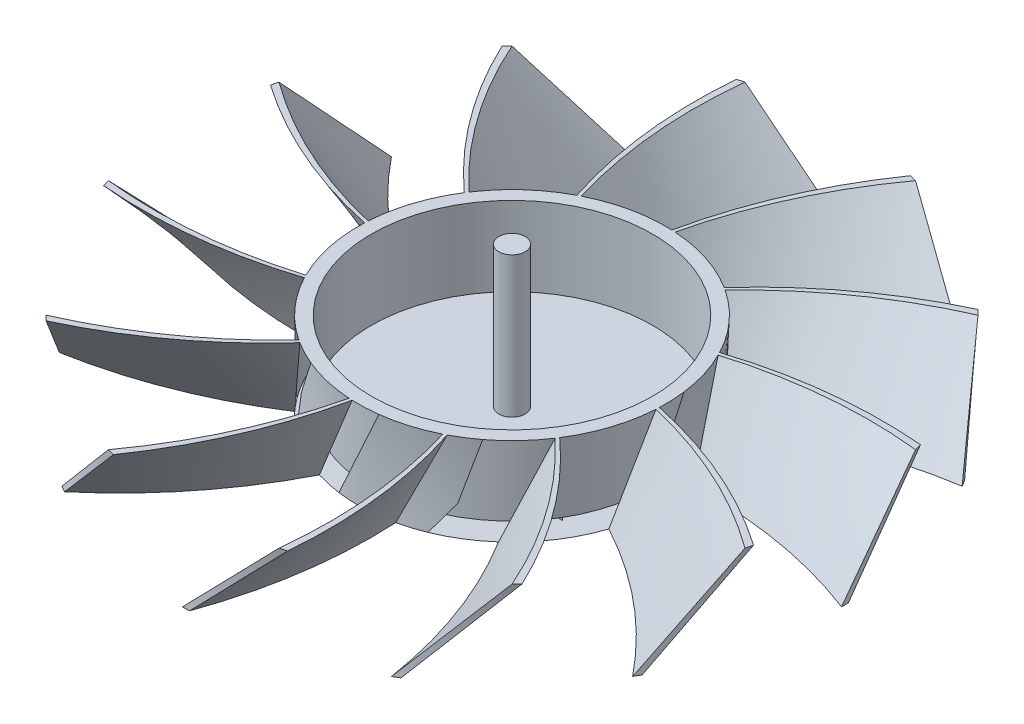
from build123d import *

# Parameters (mm, degrees)
CIRPATTERN1_COUNT   = 12
CUT_EXTRUDE1_DEPTH  = 0.5
CUT_EXTRUDE2_DEPTH  = 0.5
SKETCH5_R           = 16
CUT_EXTRUDE3_DEPTH  = 9
SKETCH6_R           = 1.5
BOSS_EXTRUDE1_DEPTH = 16


with BuildPart() as part:
    # Sketch2 → Loft2 section 0
    with BuildSketch(Plane(origin=(0, 10, 0), x_dir=(1, 0, 0), z_dir=(0, 1, 0))):
        with BuildLine():
            ThreePointArc((-8.126827561, 15.498537795), (7.961047485, -15.584342236), (-7.794361593, 15.668373475))
            ThreePointArc((-7.794361593, 15.668373475), (-9.780197697, 25.849498887), (-9.705714191, 36.222218486))
            ThreePointArc((-9.705714191, 36.222218486), (-10.091532359, 36.116630167), (-10.476202302, 36.006932462))
            ThreePointArc((-10.476202302, 36.006932462), (-10.329396762, 25.634984342), (-8.126827561, 15.498537795))
        make_face()
    # Sketch1 → Loft2 section 1
    with BuildSketch(Plane(origin=(0, 0, 0), x_dir=(1, 0, 0), z_dir=(0, 1, 0))):
        with BuildLine():
            ThreePointArc((-3.838616601, 17.073811015), (3.656267182, -17.113787141), (-3.473501701, 17.15181582))
            ThreePointArc((-3.473501701, 17.15181582), (-2.756602923, 27.5), (0, 37.5))
            ThreePointArc((0, 37.5), (-0.40002276, 37.497866363), (-0.8, 37.491465696))
            ThreePointArc((-0.8, 37.491465696), (-3.342642238, 27.434933981), (-3.838616601, 17.073811015))
        make_face()
    loft2 = loft()

    # CirPattern1: Loft2 ×12 about axis
    cirpattern1_axis = Axis((0, 10, 0), (0, 1, 0))
    for i in range(1, CIRPATTERN1_COUNT):
        add(loft2.rotate(cirpattern1_axis, i * 360 / CIRPATTERN1_COUNT))

    # Sketch3 → Cut-Extrude1 (cut)
    # profile 1 of 5: a face of its own
    with BuildSketch(Plane.XZ):
        with BuildLine():
            Line((-9.7096928, 2.305994157), (-9.599607596, 2.305994157))
            Line((-9.599607596, 2.305994157), (-9.599607596, 0.813313427))
            Line((-9.599607596, 0.813313427), (-9.7096928, 0.813313427))
            add(Edge.make_bspline(
                [(-9.7096928, 0.813313427), (-9.726150452, 0.857292674), (-9.758237442, 0.943037691), (-9.810953402, 1.06671536), (-9.865067608, 1.182923357), (-9.919315189, 1.292629176), (-9.977972031, 1.393350754), (-10.036453633, 1.487505207), (-10.095718212, 1.575257412), (-10.139074665, 1.628669335), (-10.160295796, 1.654812189)],
                knots=[0, 0, 0, 0, 1.175104864, 2.291066666, 3.363545726, 4.383364311, 5.352569365, 6.279020888, 7.157654259, 8, 8, 8, 8], degree=3))
            add(Edge.make_bspline(
                [(-10.160295796, 1.654812189), (-10.192043735, 1.689300981), (-10.256640251, 1.759474225), (-10.366220387, 1.855118159), (-10.487541147, 1.943764348), (-10.618823251, 2.026863972), (-10.760540357, 2.101982438), (-10.910910943, 2.169448284), (-11.070129361, 2.227033327), (-11.235944931, 2.275883896), (-11.406171709, 2.31628229), (-11.578480694, 2.345161084), (-11.752130874, 2.362466212), (-11.868132661, 2.364620641), (-11.926323684, 2.365701386)],
                knots=[0, 0, 0, 0, 0.861605881, 1.753081951, 2.669309869, 3.622901531, 4.607925055, 5.616572816, 6.651453525, 7.719095936, 8.794187388, 9.866964194, 10.929985983, 12, 12, 12, 12], degree=3))
            add(Edge.make_bspline(
                [(-11.926323684, 2.365701386), (-11.96864764, 2.364757792), (-12.051325576, 2.362914523), (-12.171841875, 2.349970915), (-12.285517148, 2.327627858), (-12.39179528, 2.296187872), (-12.49030217, 2.255652291), (-12.581756366, 2.208154522), (-12.665446554, 2.151478981), (-12.714538667, 2.106352803), (-12.738901757, 2.083957899)],
                knots=[0, 0, 0, 0, 1.151586221, 2.249571708, 3.29339928, 4.300036893, 5.2601469, 6.18747997, 7.100495241, 8, 8, 8, 8], degree=3))
            add(Edge.make_bspline(
                [(-12.738901757, 2.083957899), (-12.77044443, 2.049888334), (-12.833226805, 1.982076449), (-12.890854307, 1.882060857), (-12.925987122, 1.800221602), (-12.945120999, 1.739668889), (-12.956746238, 1.680140441), (-12.958309082, 1.640555043), (-12.959072165, 1.621226872)],
                knots=[0, 0, 0, 0, 1.588777153, 3.16229386, 3.927156337, 4.642500351, 5.337180238, 6, 6, 6, 6], degree=3))
            add(Edge.make_bspline(
                [(-12.959072165, 1.621226872), (-12.956869811, 1.586141857), (-12.952528148, 1.516976147), (-12.919071159, 1.41710832), (-12.864107798, 1.324891765), (-12.813461191, 1.272919784), (-12.787413881, 1.246190839)],
                knots=[0, 0, 0, 0, 0.990804432, 1.953246749, 2.947364462, 4, 4, 4, 4], degree=3))
            add(Edge.make_bspline(
                [(-12.787413881, 1.246190839), (-12.773094603, 1.232769769), (-12.743141413, 1.204695458), (-12.689484454, 1.167682738), (-12.628361869, 1.130760696), (-12.558475685, 1.093858942), (-12.478928076, 1.058563374), (-12.388813032, 1.024682325), (-12.289076981, 0.988543619), (-12.175772554, 0.954206253), (-12.04566629, 0.916699963), (-11.893573364, 0.878988361), (-11.719348615, 0.832987041), (-11.594902317, 0.803672522), (-11.52889744, 0.78812444)],
                knots=[0, 0, 0, 0, 0.522106973, 1.092147927, 1.731407964, 2.424284969, 3.195516386, 4.047724456, 4.988264309, 6.020516799, 7.200406023, 8.594674768, 10.193854901, 12, 12, 12, 12], degree=3))
            add(Edge.make_bspline(
                [(-11.52889744, 0.78812444), (-11.511480521, 0.783153401), (-11.479768524, 0.774102342), (-11.436990427, 0.761822733), (-11.403178181, 0.752869202), (-11.383383165, 0.749458955), (-11.37496474, 0.748008645)],
                knots=[0, 0, 0, 0, 1.365477475, 2.486204181, 3.356212868, 4, 4, 4, 4], degree=3))
            Line((-11.37496474, 0.748008645), (-11.220099114, 0.710691627))
            Line((-11.220099114, 0.710691627), (-10.974739719, 0.648185621))
            add(Edge.make_bspline(
                [(-10.974739719, 0.648185621), (-10.924633633, 0.635271305), (-10.827699575, 0.610287572), (-10.68792637, 0.571713795), (-10.558067547, 0.535645201), (-10.438882204, 0.50039297), (-10.330355013, 0.465788013), (-10.232307747, 0.432374317), (-10.144972584, 0.399803302), (-10.043175954, 0.359209506), (-9.927311702, 0.30516491), (-9.800105492, 0.228770318), (-9.681951148, 0.14433947), (-9.61200394, 0.078962406), (-9.577217386, 0.046448702)],
                knots=[0, 0, 0, 0, 1.209484786, 2.339840866, 3.389257254, 4.359833054, 5.244898727, 6.051764187, 6.780883699, 7.423404301, 8.613489217, 9.764137735, 10.888047912, 12, 12, 12, 12], degree=3))
            add(Edge.make_bspline(
                [(-9.577217386, 0.046448702), (-9.551782163, 0.021463072), (-9.501381188, -0.028047017), (-9.435579249, -0.111458341), (-9.378697803, -0.200873419), (-9.331238315, -0.296363752), (-9.292556421, -0.396092088), (-9.265430248, -0.500619287), (-9.249405783, -0.609210034), (-9.247163658, -0.683045572), (-9.246028849, -0.720416023)],
                knots=[0, 0, 0, 0, 0.994566719, 1.970776275, 2.958231928, 3.948279333, 4.943073372, 5.939078914, 6.956904077, 8, 8, 8, 8], degree=3))
            add(Edge.make_bspline(
                [(-9.246028849, -0.720416023), (-9.247444182, -0.758105726), (-9.250278264, -0.833576104), (-9.26847054, -0.94692161), (-9.29971391, -1.059896507), (-9.342279595, -1.17215383), (-9.396346022, -1.280693954), (-9.459910338, -1.384295828), (-9.534726944, -1.480969973), (-9.592150212, -1.539149692), (-9.621064882, -1.568445263)],
                knots=[0, 0, 0, 0, 0.950449327, 1.90319275, 2.886711018, 3.90182826, 4.925871902, 5.939989103, 6.962710778, 8, 8, 8, 8], degree=3))
            add(Edge.make_bspline(
                [(-9.621064882, -1.568445263), (-9.661226688, -1.607106311), (-9.742035845, -1.684895808), (-9.880376685, -1.783449943), (-10.031942053, -1.867174021), (-10.196803062, -1.934769584), (-10.374151452, -1.988522003), (-10.564050382, -2.0244318), (-10.765434159, -2.049023779), (-10.903758657, -2.051409397), (-10.974739719, -2.052633574)],
                knots=[0, 0, 0, 0, 0.9045502, 1.820036154, 2.749312885, 3.711811853, 4.709011819, 5.754176183, 6.847558006, 8, 8, 8, 8], degree=3))
            add(Edge.make_bspline(
                [(-10.974739719, -2.052633574), (-11.024832731, -2.052012918), (-11.123926261, -2.050785141), (-11.270294596, -2.038125304), (-11.412598611, -2.018555008), (-11.554007055, -1.991408132), (-11.700179159, -1.95141378), (-11.858108042, -1.899467115), (-12.031271625, -1.835359729), (-12.150423089, -1.785063707), (-12.2127318, -1.758762056)],
                knots=[0, 0, 0, 0, 0.937141327, 1.853844236, 2.746727261, 3.624310237, 4.546022891, 5.580194318, 6.734594038, 8, 8, 8, 8], degree=3))
            add(Edge.make_bspline(
                [(-12.2127318, -1.758762056), (-12.252204719, -1.743163811), (-12.326000453, -1.714002452), (-12.429092973, -1.674107595), (-12.518079542, -1.64445818), (-12.614008578, -1.614802326), (-12.721083091, -1.589283323), (-12.80499097, -1.585288863), (-12.845255259, -1.58337207)],
                knots=[0, 0, 0, 0, 1.157313997, 2.163631113, 3.013629022, 3.713717744, 4.902897683, 6, 6, 6, 6], degree=3))
            add(Edge.make_bspline(
                [(-12.845255259, -1.58337207), (-12.881152395, -1.584651439), (-12.951266318, -1.587150289), (-13.051905531, -1.611116766), (-13.144044479, -1.649785725), (-13.226819781, -1.703143429), (-13.298455069, -1.771275024), (-13.358033528, -1.852481556), (-13.403487206, -1.947550366), (-13.421705015, -2.016798666), (-13.431132445, -2.052633574)],
                knots=[0, 0, 0, 0, 1.052167561, 2.055083061, 3.01626263, 3.973229431, 4.928758788, 5.901782621, 6.914205425, 8, 8, 8, 8], degree=3))
            Line((-13.431132445, -2.052633574), (-13.541217649, -2.052633574))
            Line((-13.541217649, -2.052633574), (-13.541217649, -0.022587782))
            Line((-13.541217649, -0.022587782), (-13.431132445, -0.022587782))
            add(Edge.make_bspline(
                [(-13.431132445, -0.022587782), (-13.424693705, -0.066881136), (-13.411903946, -0.154864396), (-13.380064791, -0.284373362), (-13.34096774, -0.411174963), (-13.289108975, -0.533865505), (-13.23117861, -0.654668133), (-13.161351277, -0.771635832), (-13.082073619, -0.885439163), (-13.023277748, -0.958038891), (-12.993590406, -0.994696107)],
                knots=[0, 0, 0, 0, 0.992729715, 1.971934528, 2.956281341, 3.934123375, 4.924860161, 5.927328838, 6.953462282, 8, 8, 8, 8], degree=3))
            add(Edge.make_bspline(
                [(-12.993590406, -0.994696107), (-12.954548699, -1.037447811), (-12.874777498, -1.12479939), (-12.737218114, -1.244462369), (-12.586825527, -1.362210167), (-12.421554008, -1.472905381), (-12.246932667, -1.575671735), (-12.065585747, -1.667325599), (-11.879785665, -1.74658579), (-11.691376349, -1.813556376), (-11.503527844, -1.866876323), (-11.318793655, -1.903781304), (-11.139627646, -1.928973604), (-11.021466467, -1.931822571), (-10.963544614, -1.933219116)],
                knots=[0, 0, 0, 0, 0.907489387, 1.854209885, 2.85534158, 3.902523447, 4.971720046, 6.031954649, 7.087533207, 8.138219963, 9.166761867, 10.147348753, 11.091842218, 12, 12, 12, 12], degree=3))
            add(Edge.make_bspline(
                [(-10.963544614, -1.933219116), (-10.913727888, -1.931936668), (-10.815606105, -1.929410688), (-10.671966094, -1.910337414), (-10.53459876, -1.879948588), (-10.405365274, -1.835931439), (-10.285717716, -1.782108715), (-10.179115255, -1.71693567), (-10.085380244, -1.643530361), (-10.007701588, -1.558654279), (-9.944557149, -1.467052146), (-9.90020375, -1.367736048), (-9.871509623, -1.263125098), (-9.868751721, -1.190798109), (-9.867357202, -1.15422636)],
                knots=[0, 0, 0, 0, 1.20044322, 2.364459466, 3.486423352, 4.586260588, 5.64952671, 6.641950948, 7.591321289, 8.509004389, 9.405034324, 10.260485583, 11.120423993, 12, 12, 12, 12], degree=3))
            add(Edge.make_bspline(
                [(-9.867357202, -1.15422636), (-9.869741747, -1.11539538), (-9.874497221, -1.037955123), (-9.911731785, -0.925342366), (-9.973856595, -0.819743005), (-10.030297759, -0.758616208), (-10.059539846, -0.726946501)],
                knots=[0, 0, 0, 0, 0.967311257, 1.929099701, 2.927069477, 4, 4, 4, 4], degree=3))
            add(Edge.make_bspline(
                [(-10.059539846, -0.726946501), (-10.092301683, -0.698738846), (-10.16254163, -0.638262865), (-10.268561063, -0.580339962), (-10.365423017, -0.532503967), (-10.451080762, -0.496850922), (-10.546946054, -0.460291713), (-10.654575905, -0.422617662), (-10.777831065, -0.383055678), (-10.919978155, -0.340178157), (-11.082595351, -0.293686626), (-11.198279647, -0.262784905), (-11.259281983, -0.246489891)],
                knots=[0, 0, 0, 0, 0.99290735, 2.128750047, 2.765949239, 3.481366221, 4.263199952, 5.128172127, 6.106281843, 7.243274738, 8.546330957, 10, 10, 10, 10], degree=3))
            Line((-11.259281983, -0.246489891), (-11.573677862, -0.1625266))
            add(Edge.make_bspline(
                [(-11.573677862, -0.1625266), (-11.63344419, -0.146882736), (-11.748173992, -0.116852156), (-11.912257374, -0.070224715), (-12.062647866, -0.029355516), (-12.198021217, 0.011929846), (-12.320207398, 0.047016645), (-12.427307545, 0.082499929), (-12.520908688, 0.112147969), (-12.57758331, 0.133610197), (-12.603627566, 0.14347295)],
                knots=[0, 0, 0, 0, 1.379457353, 2.648060762, 3.808873198, 4.859076267, 5.808180496, 6.647040322, 7.378260919, 8, 8, 8, 8], degree=3))
            add(Edge.make_bspline(
                [(-12.603627566, 0.14347295), (-12.653884427, 0.162284217), (-12.749544126, 0.198089879), (-12.88278324, 0.256320787), (-13.000192854, 0.312140073), (-13.101394023, 0.37139293), (-13.191725102, 0.433853645), (-13.2724034, 0.504749544), (-13.349356305, 0.580870501), (-13.393793248, 0.63801999), (-13.416205638, 0.666844131)],
                knots=[0, 0, 0, 0, 1.311293851, 2.495937297, 3.553102046, 4.486458966, 5.359435164, 6.232477534, 7.108525449, 8, 8, 8, 8], degree=3))
            add(Edge.make_bspline(
                [(-13.416205638, 0.666844131), (-13.445985383, 0.708563864), (-13.504611533, 0.790695776), (-13.565838643, 0.927337908), (-13.604542306, 1.070227401), (-13.608955499, 1.167887629), (-13.611187058, 1.21727015)],
                knots=[0, 0, 0, 0, 1.032278735, 2.032204388, 3.004971519, 4, 4, 4, 4], degree=3))
            add(Edge.make_bspline(
                [(-13.611187058, 1.21727015), (-13.610408502, 1.247151849), (-13.608863072, 1.30646683), (-13.598389985, 1.394137503), (-13.581450072, 1.479556387), (-13.558513595, 1.562822526), (-13.527108279, 1.643358278), (-13.489958073, 1.721772184), (-13.44575262, 1.797992587), (-13.377010812, 1.896056432), (-13.276920588, 2.011663331), (-13.133534775, 2.132922711), (-12.969509825, 2.238576957), (-12.784982874, 2.326072957), (-12.58563668, 2.398281779), (-12.372586194, 2.447511013), (-12.149647024, 2.47960997), (-11.997341012, 2.48325828), (-11.919793206, 2.485115845)],
                knots=[0, 0, 0, 0, 0.609385397, 1.209626086, 1.797954173, 2.384261862, 2.968473317, 3.558542276, 4.152484145, 4.762990646, 5.99921114, 7.258784913, 8.579955777, 9.967070861, 11.415468994, 12.895337562, 14.419236645, 16, 16, 16, 16], degree=3))
            add(Edge.make_bspline(
                [(-11.919793206, 2.485115845), (-11.859731842, 2.483753635), (-11.738708456, 2.481008789), (-11.556309216, 2.461833973), (-11.372280281, 2.429707729), (-11.18643648, 2.38605317), (-10.999259817, 2.328709304), (-10.810817249, 2.258200654), (-10.62006596, 2.17636573), (-10.494590168, 2.113232806), (-10.430844178, 2.081159122)],
                knots=[0, 0, 0, 0, 0.925321987, 1.864519746, 2.822353237, 3.802046661, 4.803879245, 5.836271587, 6.900752026, 8, 8, 8, 8], degree=3))
            add(Edge.make_bspline(
                [(-10.430844178, 2.081159122), (-10.389773197, 2.060867449), (-10.315379532, 2.024112254), (-10.211750803, 1.984044564), (-10.130662704, 1.955103636), (-10.082378151, 1.949907382), (-10.062338623, 1.947750782)],
                knots=[0, 0, 0, 0, 1.393978184, 2.524973685, 3.387820137, 4, 4, 4, 4], degree=3))
            add(Edge.make_bspline(
                [(-10.062338623, 1.947750782), (-10.04262565, 1.948793654), (-10.003698217, 1.950853026), (-9.947653191, 1.968316952), (-9.896159178, 1.997191626), (-9.849038999, 2.037086583), (-9.806810201, 2.088445775), (-9.76982153, 2.151084746), (-9.735911387, 2.224094845), (-9.718725951, 2.277777196), (-9.7096928, 2.305994157)],
                knots=[0, 0, 0, 0, 0.871985791, 1.721920331, 2.573082536, 3.47282195, 4.44135752, 5.504730185, 6.688415689, 8, 8, 8, 8], degree=3))
        make_face()
    # profile 2 of 5: a face of its own
    with BuildSketch(Plane.XZ):
        with BuildLine():
            Line((-6.318508767, 2.485115845), (-6.20282601, 2.485115845))
            Line((-6.20282601, 2.485115845), (-4.423737165, -1.358537035))
            add(Edge.make_bspline(
                [(-4.423737165, -1.358537035), (-4.409542838, -1.387371425), (-4.382035348, -1.443250206), (-4.33498261, -1.5210686), (-4.285493362, -1.591035602), (-4.234435617, -1.654045657), (-4.180130605, -1.708962674), (-4.121743, -1.754619084), (-4.060924233, -1.793694517), (-3.995527322, -1.823719705), (-3.925339724, -1.846378704), (-3.849553562, -1.861513668), (-3.768212293, -1.872580071), (-3.711955996, -1.873195206), (-3.682994353, -1.873511887)],
                knots=[0, 0, 0, 0, 1.198973114, 2.323515578, 3.389333425, 4.395342237, 5.347281372, 6.264414564, 7.156307884, 8.039017528, 8.941867626, 9.902398825, 10.920121286, 12, 12, 12, 12], degree=3))
            Line((-3.682994353, -1.873511887), (-3.567311596, -1.873511887))
            Line((-3.567311596, -1.873511887), (-3.567311596, -1.992926345))
            Line((-3.567311596, -1.992926345), (-6.130057825, -1.992926345))
            Line((-6.130057825, -1.992926345), (-6.130057825, -1.873511887))
            Line((-6.130057825, -1.873511887), (-5.797003437, -1.873511887))
            add(Edge.make_bspline(
                [(-5.797003437, -1.873511887), (-5.758416244, -1.87255471), (-5.686623067, -1.870773841), (-5.586629069, -1.859605797), (-5.503316964, -1.838705047), (-5.435264032, -1.810040677), (-5.382095321, -1.771154509), (-5.346111644, -1.72082627), (-5.323001665, -1.662057607), (-5.3206066, -1.619678487), (-5.319345603, -1.597365952)],
                knots=[0, 0, 0, 0, 1.487820893, 2.768156541, 3.870214784, 4.788044371, 5.60090005, 6.373039189, 7.143407898, 8, 8, 8, 8], degree=3))
            add(Edge.make_bspline(
                [(-5.319345603, -1.597365952), (-5.319969832, -1.581792036), (-5.321288597, -1.548890129), (-5.329890248, -1.497512876), (-5.345900447, -1.44216146), (-5.361610674, -1.391991288), (-5.378844817, -1.346822642), (-5.395886779, -1.30599933), (-5.415288916, -1.258211313), (-5.438460235, -1.204332164), (-5.466239114, -1.144465891), (-5.495286603, -1.077412801), (-5.529461082, -1.004741857), (-5.552629348, -0.953982183), (-5.564704998, -0.927525474)],
                knots=[0, 0, 0, 0, 0.781480144, 1.650977654, 2.604715829, 3.670428144, 4.287626539, 5.029315537, 5.8898083, 6.875178979, 7.971402663, 9.200661874, 10.54094268, 12, 12, 12, 12], degree=3))
            add(Edge.make_bspline(
                [(-5.564704998, -0.927525474), (-5.568425756, -0.919124086), (-5.577670174, -0.8982504), (-5.593624659, -0.863156582), (-5.611787715, -0.821874706), (-5.626424991, -0.79403768), (-5.633741482, -0.780123252)],
                knots=[0, 0, 0, 0, 0.677231403, 1.682616631, 2.841648374, 4, 4, 4, 4], degree=3))
            Line((-5.633741482, -0.780123252), (-5.705576742, -0.619660074))
            Line((-5.705576742, -0.619660074), (-7.565830102, -0.619660074))
            Line((-7.565830102, -0.619660074), (-7.707634771, -0.946183983))
            add(Edge.make_bspline(
                [(-7.707634771, -0.946183983), (-7.726212926, -0.973686134), (-7.762038155, -1.026719969), (-7.800317302, -1.111748414), (-7.825725181, -1.196917647), (-7.828483968, -1.254499599), (-7.829848006, -1.282970073)],
                knots=[0, 0, 0, 0, 1.092102571, 2.105958536, 3.06352152, 4, 4, 4, 4], degree=3))
            add(Edge.make_bspline(
                [(-7.829848006, -1.282970073), (-7.828811039, -1.307021059), (-7.82670923, -1.355769544), (-7.807830521, -1.428484148), (-7.77758112, -1.500463694), (-7.736775572, -1.570871728), (-7.686346221, -1.636599916), (-7.626392034, -1.693515024), (-7.561297843, -1.744429604), (-7.51219273, -1.769473553), (-7.487464363, -1.782085192)],
                knots=[0, 0, 0, 0, 0.905807808, 1.835964594, 2.813915269, 3.843861011, 4.897180075, 5.925655707, 6.955401102, 8, 8, 8, 8], degree=3))
            add(Edge.make_bspline(
                [(-7.487464363, -1.782085192), (-7.460752764, -1.796720045), (-7.411697295, -1.823596741), (-7.347256969, -1.848612251), (-7.294513721, -1.858415216), (-7.24966466, -1.864589737), (-7.197443517, -1.870597461), (-7.160336319, -1.87249385), (-7.140416094, -1.873511887)],
                knots=[0, 0, 0, 0, 1.508366501, 2.770093352, 3.398272741, 4.160509807, 5.012508025, 6, 6, 6, 6], degree=3))
            Line((-7.140416094, -1.873511887), (-7.140416094, -1.992926345))
            Line((-7.140416094, -1.992926345), (-8.985742646, -1.992926345))
            Line((-8.985742646, -1.992926345), (-8.985742646, -1.873511887))
            add(Edge.make_bspline(
                [(-8.985742646, -1.873511887), (-8.954913358, -1.869451267), (-8.896145753, -1.861710806), (-8.813508741, -1.846211712), (-8.740912996, -1.827458092), (-8.675529133, -1.80580513), (-8.61414907, -1.776297875), (-8.551469109, -1.74035343), (-8.484958809, -1.697700107), (-8.441294719, -1.664253402), (-8.418523969, -1.646811001)],
                knots=[0, 0, 0, 0, 1.201932049, 2.291154661, 3.247495314, 4.099045794, 4.948727533, 5.87466625, 6.891641955, 8, 8, 8, 8], degree=3))
            add(Edge.make_bspline(
                [(-8.418523969, -1.646811001), (-8.390392058, -1.623363485), (-8.331661829, -1.574412739), (-8.249121287, -1.487685542), (-8.166980193, -1.387489526), (-8.085748305, -1.272827886), (-8.005012352, -1.143903534), (-7.923905089, -1.001133166), (-7.843608622, -0.844243058), (-7.793324105, -0.733690988), (-7.767342, -0.676568526)],
                knots=[0, 0, 0, 0, 0.745011926, 1.55534126, 2.432361811, 3.380945224, 4.413671566, 5.527876368, 6.722649082, 8, 8, 8, 8], degree=3))
            Line((-7.767342, -0.676568526), (-6.318508767, 2.485115845))
        make_face()
        Polygon((-6.651563155, 1.470092948), (-7.512653351, -0.500245615), (-5.769948598, -0.500245615), align=None, mode=Mode.SUBTRACT)
    # profile 3 of 5: a face of its own
    with BuildSketch(Plane.XZ):
        with BuildLine():
            Line((-3.202537743, 2.425408616), (0.029116038, 2.425408616))
            add(Edge.make_bspline(
                [(0.029116038, 2.425408616), (0.091335437, 2.424508916), (0.214689047, 2.422725208), (0.398179403, 2.408546969), (0.578456052, 2.384149072), (0.753095535, 2.350955768), (0.91706699, 2.311489758), (1.063950759, 2.263468497), (1.193671972, 2.212132459), (1.269430487, 2.167588396), (1.305358062, 2.146463904)],
                knots=[0, 0, 0, 0, 1.130759201, 2.2417965, 3.342492162, 4.435484294, 5.471826808, 6.404839847, 7.243514261, 8, 8, 8, 8], degree=3))
            add(Edge.make_bspline(
                [(1.305358062, 2.146463904), (1.344508767, 2.122124405), (1.420856266, 2.074660129), (1.523373772, 1.99049526), (1.612344889, 1.89939076), (1.686549939, 1.800872882), (1.745902542, 1.696910357), (1.789245527, 1.588455584), (1.815630347, 1.475390026), (1.818755659, 1.398707314), (1.820332914, 1.360007745)],
                knots=[0, 0, 0, 0, 1.122598406, 2.189170783, 3.223670974, 4.219607526, 5.186985836, 6.132804765, 7.057680004, 8, 8, 8, 8], degree=3))
            add(Edge.make_bspline(
                [(1.820332914, 1.360007745), (1.819084837, 1.328808801), (1.816601104, 1.266721375), (1.796262161, 1.175119518), (1.762641559, 1.087071399), (1.714524452, 1.002933121), (1.654808331, 0.92147783), (1.580823734, 0.844007909), (1.494864063, 0.768534479), (1.429656618, 0.724296293), (1.395851831, 0.701362372)],
                knots=[0, 0, 0, 0, 0.914121436, 1.819146455, 2.737035234, 3.667922669, 4.652806123, 5.691440467, 6.803198609, 8, 8, 8, 8], degree=3))
            add(Edge.make_bspline(
                [(1.395851831, 0.701362372), (1.337817852, 0.665796806), (1.221096426, 0.5942652), (1.06049623, 0.523936518), (0.917391917, 0.474007286), (0.790108731, 0.431810202), (0.642001414, 0.38852563), (0.536654552, 0.358879132), (0.480651959, 0.343118997)],
                knots=[0, 0, 0, 0, 1.240102876, 2.494169413, 3.186524594, 4.004268672, 4.939065397, 6, 6, 6, 6], degree=3))
            Line((0.480651959, 0.343118997), (0.480651959, 0.330990966))
            add(Edge.make_bspline(
                [(0.480651959, 0.330990966), (0.552917583, 0.316617826), (0.691174017, 0.289119563), (0.887851795, 0.240895803), (1.06453841, 0.187426992), (1.174022999, 0.145618379), (1.226059398, 0.125747366)],
                knots=[0, 0, 0, 0, 1.141709818, 2.184285132, 3.137017698, 4, 4, 4, 4], degree=3))
            add(Edge.make_bspline(
                [(1.226059398, 0.125747366), (1.289218894, 0.095899412), (1.410141946, 0.038753521), (1.573924902, -0.063324871), (1.712270981, -0.174442566), (1.826223562, -0.293887179), (1.915750261, -0.421862586), (1.9791042, -0.559180122), (2.01818904, -0.705205147), (2.022472566, -0.805692873), (2.024643589, -0.85662314)],
                knots=[0, 0, 0, 0, 1.2460538, 2.385652817, 3.435380589, 4.405161222, 5.322760204, 6.209316857, 7.092426771, 8, 8, 8, 8], degree=3))
            add(Edge.make_bspline(
                [(2.024643589, -0.85662314), (2.023954437, -0.884962421), (2.022593333, -0.940933664), (2.010928674, -1.023367593), (1.992706296, -1.103291296), (1.964927984, -1.179740522), (1.931469284, -1.254485968), (1.889283377, -1.325666878), (1.840538562, -1.394820018), (1.783139114, -1.45960792), (1.719876691, -1.522341107), (1.649501265, -1.58105312), (1.573115619, -1.636457016), (1.48894351, -1.68626474), (1.400052167, -1.735440838), (1.303577939, -1.778605985), (1.201319724, -1.819232361), (1.053662383, -1.867974602), (0.855028263, -1.919032784), (0.600153538, -1.962433423), (0.325097095, -1.988726221), (0.134908319, -1.991494913), (0.036579441, -1.992926345)],
                knots=[0, 0, 0, 0, 0.669547623, 1.322384049, 1.964244847, 2.603575304, 3.2417215, 3.897283424, 4.55609286, 5.238588294, 5.940288514, 6.660269098, 7.402822056, 8.168022942, 8.970548838, 9.802755257, 10.664058726, 11.570595727, 13.476449442, 15.505432705, 17.676278471, 20, 20, 20, 20], degree=3))
            Line((0.036579441, -1.992926345), (-3.202537743, -1.992926345))
            Line((-3.202537743, -1.992926345), (-3.202537743, -1.873511887))
            Line((-3.202537743, -1.873511887), (-3.07379403, -1.873511887))
            add(Edge.make_bspline(
                [(-3.07379403, -1.873511887), (-3.041120408, -1.873061693), (-2.977496098, -1.872185045), (-2.88542733, -1.862935007), (-2.799988701, -1.847011369), (-2.721305026, -1.825620106), (-2.648360621, -1.79878783), (-2.582400953, -1.764322733), (-2.52305172, -1.723778957), (-2.469617582, -1.677816792), (-2.424285103, -1.623886918), (-2.383422073, -1.564487645), (-2.349027261, -1.498481983), (-2.322002358, -1.42528859), (-2.300798986, -1.345915647), (-2.285008357, -1.26016433), (-2.275513695, -1.167813073), (-2.274699174, -1.104182848), (-2.274276914, -1.071195994)],
                knots=[0, 0, 0, 0, 1.202901929, 2.342372891, 3.40249073, 4.399826795, 5.342059265, 6.258897563, 7.132372786, 7.984493246, 8.845264898, 9.71874012, 10.635578419, 11.577810888, 12.586196476, 13.657573173, 14.785651162, 16, 16, 16, 16], degree=3))
            Line((-2.274276914, -1.071195994), (-2.274276914, 1.497147787))
            add(Edge.make_bspline(
                [(-2.274276914, 1.497147787), (-2.274726966, 1.530132382), (-2.275603542, 1.594377202), (-2.284862016, 1.687372115), (-2.300768092, 1.773749337), (-2.3222192, 1.853329744), (-2.348743439, 1.92704532), (-2.38374986, 1.993331699), (-2.42393175, 2.05350506), (-2.469912408, 2.107521326), (-2.523043917, 2.154257801), (-2.581822015, 2.196297565), (-2.649093539, 2.228655888), (-2.720793883, 2.258760101), (-2.800074201, 2.279284453), (-2.885402032, 2.295479175), (-2.977503035, 2.304650343), (-3.041122762, 2.305538205), (-3.07379403, 2.305994157)],
                knots=[0, 0, 0, 0, 1.20979974, 2.356353556, 3.423716746, 4.428324799, 5.377712597, 6.291116308, 7.170765862, 8.028312958, 8.884796948, 9.761482215, 10.669669904, 11.616655489, 12.610255412, 13.666401922, 14.801604287, 16, 16, 16, 16], degree=3))
            Line((-3.07379403, 2.305994157), (-3.202537743, 2.305994157))
            Line((-3.202537743, 2.305994157), (-3.202537743, 2.425408616))
        make_face()
        with BuildLine():
            Line((-1.318961247, 2.305994157), (-1.318961247, 0.395362823))
            Line((-1.318961247, 0.395362823), (-0.371108983, 0.395362823))
            add(Edge.make_bspline(
                [(-0.371108983, 0.395362823), (-0.324119597, 0.395940019), (-0.232772286, 0.397062087), (-0.100376375, 0.409694097), (0.02330583, 0.428478391), (0.137643872, 0.456940543), (0.243422372, 0.491436126), (0.339305255, 0.536122165), (0.42698239, 0.586964388), (0.504649366, 0.647575974), (0.574756181, 0.714460586), (0.633407029, 0.791324727), (0.684583696, 0.874773078), (0.72534137, 0.966811531), (0.757354473, 1.066564341), (0.77898058, 1.174243604), (0.79362441, 1.289638905), (0.79517875, 1.369288101), (0.795980763, 1.410385719)],
                knots=[0, 0, 0, 0, 1.272350437, 2.473447769, 3.599293751, 4.657538222, 5.661738529, 6.6077288, 7.517825032, 8.400655885, 9.27032906, 10.134683083, 11.011546615, 11.916404502, 12.854070514, 13.843609137, 14.887339314, 16, 16, 16, 16], degree=3))
            add(Edge.make_bspline(
                [(0.795980763, 1.410385719), (0.795412562, 1.447122078), (0.794311303, 1.518322724), (0.78159155, 1.621551688), (0.762679805, 1.717562195), (0.735171786, 1.806203462), (0.701416308, 1.887891971), (0.657477284, 1.961272281), (0.607227483, 2.028350143), (0.547843124, 2.087268754), (0.480730614, 2.139186526), (0.405441369, 2.183948146), (0.321832969, 2.222673561), (0.22921752, 2.25257454), (0.128616155, 2.277399858), (0.019569858, 2.293288701), (-0.097863526, 2.303904756), (-0.178900335, 2.305280831), (-0.220907984, 2.305994157)],
                knots=[0, 0, 0, 0, 1.131052931, 2.19215247, 3.199159915, 4.141530916, 5.047204535, 5.914682534, 6.769210384, 7.622717389, 8.483078262, 9.376817826, 10.315529877, 11.315220187, 12.370074338, 13.50408491, 14.70617403, 16, 16, 16, 16], degree=3))
            Line((-0.220907984, 2.305994157), (-1.318961247, 2.305994157))
        make_face(mode=Mode.SUBTRACT)
        with BuildLine():
            Line((-1.318961247, 0.275948364), (-1.318961247, -1.885639918))
            Line((-1.318961247, -1.885639918), (-0.336590741, -1.885639918))
            add(Edge.make_bspline(
                [(-0.336590741, -1.885639918), (-0.286185797, -1.884710593), (-0.18830975, -1.882906036), (-0.045785259, -1.869933905), (0.087661563, -1.847651929), (0.212206948, -1.81702942), (0.32770753, -1.77810419), (0.43390484, -1.729602761), (0.530455798, -1.671102731), (0.618740358, -1.60528272), (0.69634235, -1.529768185), (0.765160894, -1.447813663), (0.822305509, -1.357206278), (0.868985613, -1.259757769), (0.905726893, -1.154999001), (0.931667471, -1.043034198), (0.946460016, -0.923255024), (0.948738937, -0.841115422), (0.949913463, -0.798781761)],
                knots=[0, 0, 0, 0, 1.263204796, 2.452884235, 3.582992361, 4.651005666, 5.663996198, 6.633477101, 7.570458559, 8.488579281, 9.387038039, 10.278165087, 11.164644766, 12.064015785, 12.980977953, 13.941362344, 14.939005479, 16, 16, 16, 16], degree=3))
            add(Edge.make_bspline(
                [(0.949913463, -0.798781761), (0.949422627, -0.762656077), (0.948462866, -0.69201745), (0.934369943, -0.589178574), (0.914856212, -0.491346459), (0.884139462, -0.399899998), (0.847701284, -0.313083372), (0.79959692, -0.233776602), (0.746458087, -0.157831215), (0.703042679, -0.113763653), (0.681230932, -0.091624265)],
                knots=[0, 0, 0, 0, 1.113554755, 2.177397576, 3.197243963, 4.186300944, 5.148756876, 6.094864071, 7.042866445, 8, 8, 8, 8], degree=3))
            add(Edge.make_bspline(
                [(0.681230932, -0.091624265), (0.646368741, -0.058503636), (0.576683877, 0.007700082), (0.45585934, 0.087481391), (0.324530861, 0.151881116), (0.205927702, 0.191149109), (0.10288795, 0.215478541), (0.016801214, 0.232605128), (-0.078398637, 0.244588512), (-0.181472017, 0.257710054), (-0.293624316, 0.26507873), (-0.413948608, 0.272015984), (-0.542745483, 0.275626284), (-0.631393568, 0.275838781), (-0.677108533, 0.275948364)],
                knots=[0, 0, 0, 0, 1.193623395, 2.385893845, 3.582293491, 4.821882335, 5.481971843, 6.214353889, 7.002710796, 7.866783078, 8.797179715, 9.796022239, 10.863429869, 12, 12, 12, 12], degree=3))
            Line((-0.677108533, 0.275948364), (-1.318961247, 0.275948364))
        make_face(mode=Mode.SUBTRACT)
    # profile 4 of 5: a face of its own
    with BuildSketch(Plane.XZ):
        with BuildLine():
            Line((5.469004373, 0.156533906), (4.472639986, 0.156533906))
            Line((4.472639986, 0.156533906), (4.472639986, -1.073994771))
            add(Edge.make_bspline(
                [(4.472639986, -1.073994771), (4.473054954, -1.106672382), (4.473855147, -1.169685498), (4.483439749, -1.261087486), (4.498927368, -1.346061607), (4.521354499, -1.424736104), (4.549679332, -1.497057554), (4.582390173, -1.564097797), (4.624622757, -1.622968293), (4.671077657, -1.676908216), (4.724876496, -1.723810549), (4.78505602, -1.764252883), (4.852063112, -1.797656519), (4.925038054, -1.825944043), (5.004643486, -1.846783672), (5.090304227, -1.862985868), (5.182394215, -1.872171098), (5.246015508, -1.873056961), (5.27868758, -1.873511887)],
                knots=[0, 0, 0, 0, 1.201621739, 2.317119521, 3.376109128, 4.375465689, 5.320787859, 6.231420348, 7.110465611, 7.97782172, 8.845177828, 9.727195358, 10.637827846, 11.593817963, 12.601130375, 13.660119983, 14.798378261, 16, 16, 16, 16], degree=3))
            Line((5.27868758, -1.873511887), (5.409297144, -1.873511887))
            Line((5.409297144, -1.873511887), (5.409297144, -1.992926345))
            Line((5.409297144, -1.992926345), (2.598392744, -1.992926345))
            Line((2.598392744, -1.992926345), (2.598392744, -1.873511887))
            Line((2.598392744, -1.873511887), (2.717807203, -1.873511887))
            add(Edge.make_bspline(
                [(2.717807203, -1.873511887), (2.750478998, -1.873056175), (2.814099751, -1.872168781), (2.906193538, -1.862994319), (2.991841176, -1.846754985), (3.071210641, -1.826116519), (3.143516645, -1.797643335), (3.209600803, -1.764247042), (3.268861488, -1.723796342), (3.321680903, -1.676857483), (3.367362328, -1.623004191), (3.408166028, -1.563540452), (3.442577664, -1.497553069), (3.469597797, -1.424354495), (3.490802563, -1.344983065), (3.506592784, -1.259231305), (3.516087563, -1.166880175), (3.516902067, -1.103249932), (3.517324319, -1.070263069)],
                knots=[0, 0, 0, 0, 1.202353652, 2.341305248, 3.40093989, 4.408865861, 5.354763831, 6.255756882, 7.128833979, 7.988146677, 8.848525993, 9.721603089, 10.638023497, 11.579826501, 12.587752472, 13.65864084, 14.786204657, 16, 16, 16, 16], degree=3))
            Line((3.517324319, -1.070263069), (3.517324319, 1.502745339))
            add(Edge.make_bspline(
                [(3.517324319, 1.502745339), (3.516903288, 1.535734243), (3.516083237, 1.599987456), (3.506432675, 1.692868645), (3.491908959, 1.779395552), (3.470804, 1.858944051), (3.442211419, 1.931474), (3.409145674, 1.99781801), (3.369530224, 2.057513288), (3.323467392, 2.110276063), (3.270486511, 2.15633859), (3.21121451, 2.196515482), (3.145861868, 2.231510117), (3.072805135, 2.258219982), (2.99346739, 2.279481054), (2.90740374, 2.295338094), (2.814730345, 2.304711568), (2.750792893, 2.305557656), (2.717807203, 2.305994157)],
                knots=[0, 0, 0, 0, 1.212213306, 2.361054512, 3.428529135, 4.435141395, 5.3798065, 6.289806035, 7.155352303, 8.00597424, 8.856596177, 9.728535322, 10.633639255, 11.574214732, 12.580826992, 13.650319585, 14.787786694, 16, 16, 16, 16], degree=3))
            Line((2.717807203, 2.305994157), (2.598392744, 2.305994157))
            Line((2.598392744, 2.305994157), (2.598392744, 2.425408616))
            Line((2.598392744, 2.425408616), (6.022229169, 2.425408616))
            add(Edge.make_bspline(
                [(6.022229169, 2.425408616), (6.078830259, 2.425006471), (6.188941854, 2.424224139), (6.34943319, 2.419444655), (6.500951825, 2.412313352), (6.64316325, 2.401366279), (6.776276115, 2.386237164), (6.900407795, 2.368549348), (7.015769152, 2.348717855), (7.154424737, 2.316580653), (7.313678107, 2.268583544), (7.486228397, 2.190706729), (7.640304835, 2.097192994), (7.725695473, 2.017680685), (7.767732698, 1.978537322)],
                knots=[0, 0, 0, 0, 1.1026507, 2.145093463, 3.127710445, 4.057454617, 4.923156212, 5.737071024, 6.500013756, 7.202472385, 8.509293697, 9.732155867, 10.883555914, 12, 12, 12, 12], degree=3))
            add(Edge.make_bspline(
                [(7.767732698, 1.978537322), (7.789095636, 1.955339592), (7.832224573, 1.908506452), (7.887540587, 1.829827006), (7.936545888, 1.74519716), (7.977694285, 1.655337794), (8.01269191, 1.563052286), (8.036470121, 1.469428784), (8.052624855, 1.376427422), (8.054260611, 1.31436086), (8.055073738, 1.283507857)],
                knots=[0, 0, 0, 0, 0.982726558, 1.983994524, 2.992191763, 4.029367408, 5.063590783, 6.065797937, 7.038517031, 8, 8, 8, 8], degree=3))
            add(Edge.make_bspline(
                [(8.055073738, 1.283507857), (8.053853755, 1.242636929), (8.051446961, 1.162006401), (8.025912043, 1.0446783), (7.986713331, 0.93353087), (7.931893129, 0.828284448), (7.860172589, 0.730254373), (7.773121279, 0.638190918), (7.671081938, 0.551613344), (7.593905925, 0.502080224), (7.554092768, 0.476527338)],
                knots=[0, 0, 0, 0, 0.983034381, 1.939338918, 2.877490213, 3.815551803, 4.786411914, 5.793214062, 6.861574848, 8, 8, 8, 8], degree=3))
            add(Edge.make_bspline(
                [(7.554092768, 0.476527338), (7.519845634, 0.458834737), (7.446890656, 0.421145065), (7.324964679, 0.373944432), (7.186434912, 0.328090951), (6.980226641, 0.272185659), (6.711447023, 0.213947337), (6.492074021, 0.188664768), (6.383271321, 0.176125341)],
                knots=[0, 0, 0, 0, 0.570533791, 1.215379956, 1.933391765, 2.731167072, 4.378752872, 6, 6, 6, 6], degree=3))
            add(Edge.make_bspline(
                [(6.383271321, 0.176125341), (6.360887517, 0.174463387), (6.313661582, 0.170956953), (6.238669755, 0.167665562), (6.155665538, 0.163604576), (6.064223752, 0.160914408), (5.964387472, 0.159361988), (5.856176452, 0.157185719), (5.739864929, 0.156353364), (5.659632126, 0.156472495), (5.618272446, 0.156533906)],
                knots=[0, 0, 0, 0, 0.703745394, 1.484780516, 2.353474026, 3.309495962, 4.35300933, 5.484265384, 6.703149161, 8, 8, 8, 8], degree=3))
            Line((5.618272446, 0.156533906), (5.618272446, 0.144405875))
            add(Edge.make_bspline(
                [(5.618272446, 0.144405875), (5.659565934, 0.118179445), (5.739622288, 0.067333839), (5.857100861, -0.004876658), (5.969068583, -0.069328038), (6.109737526, -0.144829931), (6.28289197, -0.226325297), (6.458412419, -0.297021613), (6.603292026, -0.345999772), (6.719416553, -0.378919352), (6.842118482, -0.411911622), (6.926790543, -0.431471032), (6.970081433, -0.441471311)],
                knots=[0, 0, 0, 0, 0.989780157, 1.918902832, 2.789874643, 3.60340579, 5.148610692, 6.659367881, 7.429397497, 8.241832945, 9.10108937, 10, 10, 10, 10], degree=3))
            Line((6.970081433, -0.441471311), (7.073636158, -0.599135714))
            add(Edge.make_bspline(
                [(7.073636158, -0.599135714), (7.089636875, -0.622676779), (7.119408609, -0.666478465), (7.158734572, -0.728672203), (7.19431648, -0.779501172), (7.230749876, -0.839142148), (7.278498388, -0.910471241), (7.316536162, -0.967934554), (7.336721137, -0.998427809)],
                knots=[0, 0, 0, 0, 1.071377605, 1.993458873, 2.769399216, 3.405936679, 4.623444599, 6, 6, 6, 6], degree=3))
            add(Edge.make_bspline(
                [(7.336721137, -0.998427809), (7.364845416, -1.041769471), (7.419404281, -1.125848848), (7.501826918, -1.246531238), (7.581551012, -1.358615017), (7.659769567, -1.460042241), (7.731502113, -1.551439001), (7.80049002, -1.626083263), (7.859148038, -1.68960205), (7.899566375, -1.723041701), (7.917933696, -1.738237696)],
                knots=[0, 0, 0, 0, 1.313652749, 2.548381848, 3.715725439, 4.810091755, 5.805397304, 6.667583828, 7.394509569, 8, 8, 8, 8], degree=3))
            add(Edge.make_bspline(
                [(7.917933696, -1.738237696), (7.935414052, -1.749264651), (7.971400251, -1.771965459), (8.031508098, -1.797990588), (8.096227018, -1.821631045), (8.166350362, -1.841223432), (8.242155674, -1.856076244), (8.323250294, -1.865784279), (8.409772843, -1.872839128), (8.469276711, -1.873282416), (8.500079181, -1.873511887)],
                knots=[0, 0, 0, 0, 0.817553247, 1.68306836, 2.58708467, 3.546472698, 4.56351669, 5.643721884, 6.780261055, 8, 8, 8, 8], degree=3))
            Line((8.500079181, -1.873511887), (8.622292416, -1.873511887))
            Line((8.622292416, -1.873511887), (8.622292416, -1.992926345))
            Line((8.622292416, -1.992926345), (7.001800898, -1.992926345))
            Line((7.001800898, -1.992926345), (5.469004373, 0.156533906))
        make_face()
        with BuildLine():
            Line((4.472639986, 0.275948364), (5.735821054, 0.275948364))
            add(Edge.make_bspline(
                [(5.735821054, 0.275948364), (5.807084815, 0.277022275), (5.9434079, 0.2790766), (6.137926403, 0.299366852), (6.312269178, 0.333436685), (6.467548141, 0.38026655), (6.603460788, 0.443231136), (6.721694308, 0.519804463), (6.821442742, 0.61136736), (6.902172728, 0.718346399), (6.96560502, 0.840184009), (7.008383046, 0.978622495), (7.036364698, 1.131867897), (7.03878787, 1.239524601), (7.040050842, 1.295635888)],
                knots=[0, 0, 0, 0, 1.350300784, 2.58304035, 3.700758403, 4.712992955, 5.649061865, 6.530153912, 7.372652008, 8.201327671, 9.058053739, 9.96203005, 10.937798454, 12, 12, 12, 12], degree=3))
            add(Edge.make_bspline(
                [(7.040050842, 1.295635888), (7.039415808, 1.336442582), (7.038179293, 1.415900036), (7.021121188, 1.530610531), (6.997926012, 1.63827532), (6.962277807, 1.737598562), (6.915996478, 1.828728368), (6.861075185, 1.912717984), (6.794763805, 1.987587004), (6.719459856, 2.055813714), (6.633276842, 2.115145512), (6.537301348, 2.166901357), (6.431004641, 2.209498862), (6.314854823, 2.244776002), (6.188876963, 2.272742281), (6.052856178, 2.291710272), (5.907095615, 2.304315768), (5.806441024, 2.305422713), (5.754479563, 2.305994157)],
                knots=[0, 0, 0, 0, 1.04759633, 2.039845137, 2.974223105, 3.874064963, 4.742488356, 5.595779195, 6.445244775, 7.305318815, 8.200892624, 9.126929757, 10.101876705, 11.138257986, 12.24337251, 13.414170929, 14.66510355, 16, 16, 16, 16], degree=3))
            Line((5.754479563, 2.305994157), (4.472639986, 2.305994157))
            Line((4.472639986, 2.305994157), (4.472639986, 0.275948364))
        make_face(mode=Mode.SUBTRACT)
    # profile 5 of 5: a face of its own
    with BuildSketch(Plane.XZ):
        with BuildLine():
            Line((8.92735904, 2.425408616), (13.632102116, 2.425408616))
            Line((13.632102116, 2.425408616), (13.632102116, 0.720020882))
            Line((13.632102116, 0.720020882), (13.537876645, 0.720020882))
            add(Edge.make_bspline(
                [(13.537876645, 0.720020882), (13.517043688, 0.789775815), (13.47794614, 0.920686033), (13.418680434, 1.102207579), (13.363235925, 1.255964756), (13.30889119, 1.385465325), (13.251227012, 1.499185638), (13.189323111, 1.606182015), (13.11864295, 1.709868192), (13.066249066, 1.775487352), (13.039694451, 1.808744889)],
                knots=[0, 0, 0, 0, 1.447635074, 2.716800271, 3.796716971, 4.69722576, 5.507540922, 6.330592663, 7.153899913, 8, 8, 8, 8], degree=3))
            add(Edge.make_bspline(
                [(13.039694451, 1.808744889), (13.006851027, 1.845854413), (12.942882864, 1.918131532), (12.837052807, 2.011700093), (12.726527594, 2.089127961), (12.647502808, 2.126950929), (12.60868289, 2.145530979)],
                knots=[0, 0, 0, 0, 1.076868837, 2.097385523, 3.065364924, 4, 4, 4, 4], degree=3))
            add(Edge.make_bspline(
                [(12.60868289, 2.145530979), (12.575547917, 2.158365705), (12.508376107, 2.184384491), (12.403554138, 2.216550794), (12.293841376, 2.245179873), (12.178395936, 2.266789258), (12.058025287, 2.284929827), (11.932493134, 2.296581445), (11.801798636, 2.304288439), (11.712775113, 2.305417953), (11.667361105, 2.305994157)],
                knots=[0, 0, 0, 0, 0.887292397, 1.798735042, 2.736925273, 3.717963014, 4.73077341, 5.776497595, 6.865713758, 8, 8, 8, 8], degree=3))
            Line((11.667361105, 2.305994157), (10.801606281, 2.305994157))
            Line((10.801606281, 2.305994157), (10.801606281, 0.216241135))
            Line((10.801606281, 0.216241135), (11.03390472, 0.216241135))
            add(Edge.make_bspline(
                [(11.03390472, 0.216241135), (11.07631162, 0.217227366), (11.159216508, 0.219155435), (11.279883555, 0.242195086), (11.394589941, 0.27561644), (11.501622378, 0.326300977), (11.602449149, 0.389154724), (11.696537717, 0.466264945), (11.782580306, 0.558727486), (11.833471261, 0.627750508), (11.859543749, 0.663112429)],
                knots=[0, 0, 0, 0, 1.036941302, 2.027205501, 2.997955775, 3.955233612, 4.916530786, 5.901246421, 6.924765152, 8, 8, 8, 8], degree=3))
            add(Edge.make_bspline(
                [(11.859543749, 0.663112429), (11.885076745, 0.70268913), (11.936959859, 0.78310909), (11.997959401, 0.9162061), (12.052601167, 1.058565363), (12.078529833, 1.159115166), (12.091842187, 1.210739672)],
                knots=[0, 0, 0, 0, 0.943942363, 1.918093296, 2.931102794, 4, 4, 4, 4], degree=3))
            add(Edge.make_bspline(
                [(12.091842187, 1.210739672), (12.098357953, 1.23586304), (12.112746339, 1.291341506), (12.129161585, 1.383485663), (12.14777205, 1.491190542), (12.156918594, 1.56861373), (12.161811597, 1.610031767)],
                knots=[0, 0, 0, 0, 0.767407356, 1.694620835, 2.766722441, 4, 4, 4, 4], degree=3))
            Line((12.161811597, 1.610031767), (12.271896801, 1.610031767))
            Line((12.271896801, 1.610031767), (12.271896801, -1.2876347))
            Line((12.271896801, -1.2876347), (12.161811597, -1.2876347))
            add(Edge.make_bspline(
                [(12.161811597, -1.2876347), (12.148535803, -1.21192086), (12.122697444, -1.064560829), (12.080949106, -0.885661197), (12.047236165, -0.751882511), (12.017577173, -0.663258533), (11.988607688, -0.583665263), (11.945024355, -0.489938218), (11.881827552, -0.37832855), (11.820952224, -0.295641168), (11.78957434, -0.253020369)],
                knots=[0, 0, 0, 0, 1.657533368, 3.22601746, 3.961354312, 4.631593595, 5.240758324, 5.786964186, 6.859301734, 8, 8, 8, 8], degree=3))
            add(Edge.make_bspline(
                [(11.78957434, -0.253020369), (11.765386526, -0.224977644), (11.71755047, -0.169517759), (11.634044785, -0.098578782), (11.544690022, -0.037374293), (11.446666888, 0.011796633), (11.341254388, 0.049401193), (11.228619331, 0.078024938), (11.108347476, 0.093481717), (11.02586012, 0.095692222), (10.983526745, 0.096826677)],
                knots=[0, 0, 0, 0, 0.975144931, 1.928536682, 2.879138924, 3.825203998, 4.810840928, 5.825052962, 6.883794419, 8, 8, 8, 8], degree=3))
            Line((10.983526745, 0.096826677), (10.801606281, 0.096826677))
            Line((10.801606281, 0.096826677), (10.801606281, -1.873511887))
            Line((10.801606281, -1.873511887), (11.525556436, -1.873511887))
            add(Edge.make_bspline(
                [(11.525556436, -1.873511887), (11.577808351, -1.872969079), (11.679584237, -1.871911801), (11.828136275, -1.86388043), (11.9683932, -1.848369955), (12.101232997, -1.829549936), (12.226815854, -1.8033671), (12.345381026, -1.770522759), (12.457857324, -1.73266151), (12.563964399, -1.687293795), (12.665928616, -1.63581961), (12.763326011, -1.575786715), (12.858441881, -1.509582776), (12.918132807, -1.460045702), (12.948267756, -1.435036922)],
                knots=[0, 0, 0, 0, 1.234440084, 2.404433048, 3.512687447, 4.567263271, 5.572981436, 6.540794094, 7.47243388, 8.374402339, 9.264807393, 10.168210871, 11.075221716, 12, 12, 12, 12], degree=3))
            add(Edge.make_bspline(
                [(12.948267756, -1.435036922), (12.997954921, -1.389844035), (13.09736287, -1.29942768), (13.225802147, -1.142624715), (13.338938985, -0.971167994), (13.397279145, -0.846254909), (13.426858515, -0.782922028)],
                knots=[0, 0, 0, 0, 0.986861948, 1.974391658, 2.972984996, 4, 4, 4, 4], degree=3))
            add(Edge.make_bspline(
                [(13.426858515, -0.782922028), (13.443606964, -0.742290413), (13.479401867, -0.655452238), (13.530859037, -0.514090633), (13.581377158, -0.352459993), (13.614597377, -0.237846646), (13.632102116, -0.177453407)],
                knots=[0, 0, 0, 0, 0.824292771, 1.761684315, 2.820563783, 4, 4, 4, 4], degree=3))
            Line((13.632102116, -0.177453407), (13.748717798, -0.177453407))
            Line((13.748717798, -0.177453407), (13.748717798, -1.992926345))
            Line((13.748717798, -1.992926345), (8.932956593, -1.992926345))
            Line((8.932956593, -1.992926345), (8.92735904, -1.873511887))
            Line((8.92735904, -1.873511887), (9.046773498, -1.873511887))
            add(Edge.make_bspline(
                [(9.046773498, -1.873511887), (9.079156663, -1.873227638), (9.141924305, -1.872676683), (9.232459581, -1.861250909), (9.317366829, -1.847417086), (9.395789705, -1.824848267), (9.467907598, -1.795875995), (9.53407111, -1.761151548), (9.594189822, -1.720145366), (9.647412979, -1.672137852), (9.69517239, -1.618484977), (9.734649268, -1.557199537), (9.769882044, -1.490698835), (9.797227445, -1.417425532), (9.820205585, -1.338348421), (9.835443688, -1.252669266), (9.845054291, -1.160668178), (9.845869781, -1.097343968), (9.846290614, -1.064665516)],
                knots=[0, 0, 0, 0, 1.190227921, 2.306995074, 3.352715033, 4.352105868, 5.30167326, 6.207437804, 7.09591615, 7.970888068, 8.838273924, 9.729840082, 10.645734044, 11.601756948, 12.601147783, 13.671420971, 14.798337049, 16, 16, 16, 16], degree=3))
            Line((9.846290614, -1.064665516), (9.846290614, 1.503678265))
            add(Edge.make_bspline(
                [(9.846290614, 1.503678265), (9.845869583, 1.536667167), (9.845049531, 1.600920378), (9.835398977, 1.693801583), (9.820875232, 1.780328432), (9.79977037, 1.859877132), (9.771177459, 1.932406394), (9.738112866, 1.998752802), (9.698493374, 2.058439663), (9.65244522, 2.111233008), (9.599409281, 2.157180861), (9.540469273, 2.197720107), (9.474320739, 2.230976202), (9.402196536, 2.25979233), (9.322216875, 2.27903748), (9.236410556, 2.295472123), (9.143685453, 2.304674565), (9.079755381, 2.305545063), (9.046773498, 2.305994157)],
                knots=[0, 0, 0, 0, 1.212525589, 2.361662751, 3.42941237, 4.436283947, 5.381192411, 6.291426374, 7.157195618, 8.008036687, 8.858877756, 9.731041525, 10.631092045, 11.576000509, 12.579946166, 13.649714276, 14.787474411, 16, 16, 16, 16], degree=3))
            Line((9.046773498, 2.305994157), (8.92735904, 2.305994157))
            Line((8.92735904, 2.305994157), (8.92735904, 2.425408616))
        make_face()
    extrude(amount=-CUT_EXTRUDE1_DEPTH, mode=Mode.SUBTRACT)

    # Sketch4 → Cut-Extrude2 (cut)
    with BuildSketch(Plane.XZ):
        Polygon((-13.089821228, 7.370481119), (-1.589821228, 7.370481119), (-1.589821228, 3.594204962), (-3.589821228, 3.594204962), (-3.589821228, 5.370481119), (-11.089821228, 5.370481119), align=None)
        Polygon((-3.589821228, -2.796882057), (-3.589821228, -12.246728681), (-1.589821228, -14.246728681), (-1.589821228, -2.796882057), align=None)
        Polygon((3.589821228, -2.796882057), (3.589821228, -12.246728681), (1.589821228, -14.246728681), (1.589821228, -2.796882057), align=None)
        Polygon((3.589821228, 3.594204962), (3.589821228, 5.370481119), (11.089821228, 5.370481119), (13.089821228, 7.370481119), (1.589821228, 7.370481119), (1.589821228, 3.594204962), align=None)
    extrude(amount=-CUT_EXTRUDE2_DEPTH, mode=Mode.SUBTRACT)

    # Sketch5 → Cut-Extrude3 (cut)
    with BuildSketch(Plane(origin=(0, 10, 0), x_dir=(1, 0, 0), z_dir=(0, 1, 0))):
        Circle(SKETCH5_R)
    extrude(amount=-CUT_EXTRUDE3_DEPTH, mode=Mode.SUBTRACT)

    # Sketch6 → Boss-Extrude1 (add)
    with BuildSketch(Plane(origin=(0, 1, 0), x_dir=(1, 0, 0), z_dir=(0, 1, 0))):
        Circle(SKETCH6_R)
    extrude(amount=BOSS_EXTRUDE1_DEPTH)


solid = part.part
